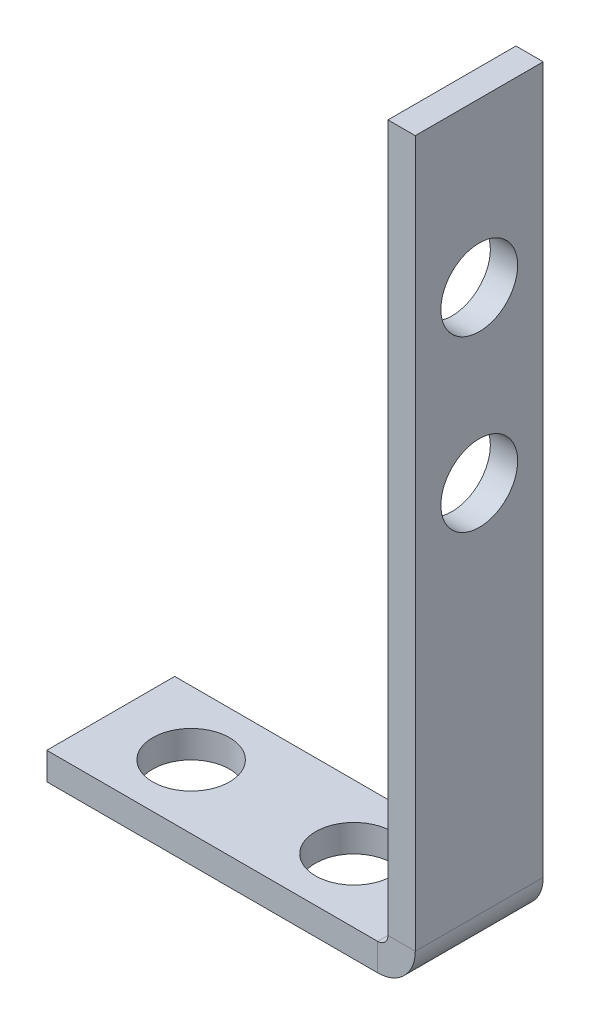
from build123d import *

# Parameters (mm, degrees)
BASE_FLANGE1_DEPTH = 7.5
SKETCH7_R          = 2.25
CUT_EXTRUDE1_DEPTH = 10
SKETCH8_R          = 2.25
CUT_EXTRUDE2_DEPTH = 10


# Sheet-metal steps are written as plain solids
with BuildPart() as part:
    # Sketch1 → Base-Flange1 (new body)
    with BuildSketch(Plane.XY):
        with BuildLine():
            Line((-20, 0), (-0.6, 0))
            ThreePointArc((-0.6, 0), (-0.175735931, 0.175735931), (0, 0.6))
            Line((0, 0.6), (0, 42))
            Line((0, 42), (1.6, 42))
            Line((1.6, 42), (1.6, 0.6))
            ThreePointArc((1.6, 0.6), (0.955634919, -0.955634919), (-0.6, -1.6))
            Line((-0.6, -1.6), (-20, -1.6))
            Line((-20, -1.6), (-20, 0))
        make_face()
    extrude(amount=BASE_FLANGE1_DEPTH)

    # Sketch7 → Cut-Extrude1 (cut)
    with BuildSketch(Plane(origin=(1.6, 0, 0), x_dir=(0, 0, -1), z_dir=(1, 0, 0))):
        with Locations((-3.75, 32.425)):
            Circle(SKETCH7_R)
        with Locations((-3.75, 22.49)):
            Circle(SKETCH7_R)
    extrude(amount=-CUT_EXTRUDE1_DEPTH, mode=Mode.SUBTRACT)

    # Sketch8 → Cut-Extrude2 (cut)
    with BuildSketch(Plane(origin=(0, 0, 0), x_dir=(1, 0, 0), z_dir=(0, 1, 0))):
        with Locations(Location((-15.288441883, -3.75, 0), (0, 0, 270))):
            Circle(SKETCH8_R)
        with Locations(Location((-5.743540806, -3.75, 0), (0, 0, 270))):
            Circle(SKETCH8_R)
    extrude(amount=-CUT_EXTRUDE2_DEPTH, mode=Mode.SUBTRACT)


solid = part.part
